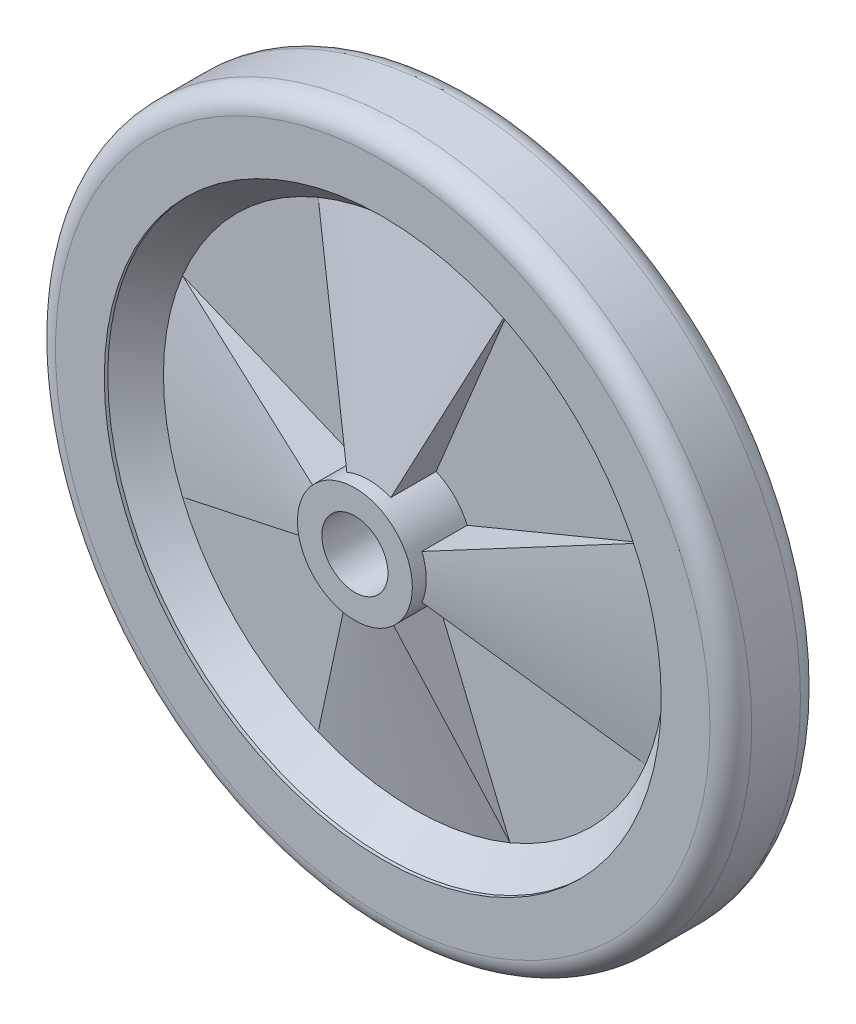
from build123d import *

# Parameters (mm, degrees)
BOSS_EXTRUDE1_DEPTH      = 10.5
BOSS_EXTRUDE1_DEPTH_BACK = 10.5
SKETCH1_R                = 8.25
SKETCH1_R_2              = 4.75
BOSS_EXTRUDE2_DEPTH      = 6.5
BOSS_EXTRUDE2_DEPTH_BACK = 6.5
SKETCH2_R                = 50
SKETCH2_R_2              = 40
BOSS_EXTRUDE3_DEPTH      = 2
BOSS_EXTRUDE3_DEPTH_BACK = 2
SKETCH3_R                = 40
SKETCH3_R_2              = 8.25
CHAMFER1_SIZE            = 4
FILLET1_R                = 3
REVOLVE1_ANGLE           = 45
CIRPATTERN1_COUNT        = 4
MIRROR1_COPY_1_ANGLE     = 45
MIRROR1_COPY_2_ANGLE     = 45
MIRROR1_COPY_3_ANGLE     = 45


# Read off the part's stored shape, not the designer's step: Revolve1
with BuildPart() as part:
    # Sketch1 → Boss-Extrude1 (new, two sides: drawn at the far end of the back side and taken through both)
    with BuildSketch(Plane.XY.offset(-BOSS_EXTRUDE1_DEPTH_BACK)):
        Circle(SKETCH1_R)
        Circle(SKETCH1_R_2, mode=Mode.SUBTRACT)
    extrude(amount=BOSS_EXTRUDE1_DEPTH + BOSS_EXTRUDE1_DEPTH_BACK)



with BuildPart() as body_2:
    # Sketch2 → Boss-Extrude2 (new, two sides: drawn at the far end of the back side and taken through both)
    with BuildSketch(Plane.XY.offset(-BOSS_EXTRUDE2_DEPTH_BACK)):
        Circle(SKETCH2_R)
        Circle(SKETCH2_R_2, mode=Mode.SUBTRACT)
    extrude(amount=BOSS_EXTRUDE2_DEPTH + BOSS_EXTRUDE2_DEPTH_BACK)


with BuildPart() as part_1:
    add(part.part)

    add(body_2.part)  # Boss-Extrude3 merges body 2
    # Sketch3 → Boss-Extrude3 (add, two sides: drawn at the far end of the back side and taken through both)
    with BuildSketch(Plane.XY.offset(-BOSS_EXTRUDE3_DEPTH_BACK)):
        Circle(SKETCH3_R)
        Circle(SKETCH3_R_2, mode=Mode.SUBTRACT)
    extrude(amount=BOSS_EXTRUDE3_DEPTH + BOSS_EXTRUDE3_DEPTH_BACK)

    # Chamfer1
    chamfer1_edges = [part_1.edges().sort_by_distance(p)[0] for p in [
        (-40, 0, -2),
        (-40, 0, 2),
    ]]
    chamfer(chamfer1_edges, length=CHAMFER1_SIZE)

    # Fillet1
    fillet1_edges = [part_1.edges().sort_by_distance(p)[0] for p in [
        (-50, 0, -6.5),
        (-50, 0, 6.5),
    ]]
    fillet(fillet1_edges, radius=FILLET1_R)

    # Revolve1 outline → Revolve1 (revolve)
    with BuildSketch(Plane(origin=(0, 0, 0), x_dir=(-0.9238795325112862, 0.3826834323650911, 0), z_dir=(0.3826834323650911, 0.9238795325112862, 0))):
        Polygon((36, 2), (8.25, 8.5), (8.25, 2), align=None)
    revolve1 = revolve(axis=Axis((0, 0, 0), (0, 0, 1)), revolution_arc=REVOLVE1_ANGLE)

    # CirPattern1: Revolve1 ×4 about axis
    cirpattern1_axis = Axis((0, 0, -10.5), (0, 0, 1))
    for i in range(1, CIRPATTERN1_COUNT):
        add(revolve1.rotate(cirpattern1_axis, i * 360 / CIRPATTERN1_COUNT))

    # Mirror1: Revolve1 across plane
    add(revolve1.mirror(Plane.XY))

    # Mirror1 copy 1 sketch → Mirror1 copy 1 (revolve)
    with BuildSketch(Plane(origin=(0, 0, 0), x_dir=(-0.38268343236509117, -0.9238795325112862, 0), z_dir=(-0.9238795325112862, 0.38268343236509117, 0))):
        Polygon((36, -2), (8.25, -8.5), (8.25, -2), align=None)
    revolve(axis=Axis((0, 0, 0), (0, 0, 1)), revolution_arc=MIRROR1_COPY_1_ANGLE)

    # Mirror1 copy 2 sketch → Mirror1 copy 2 (revolve)
    with BuildSketch(Plane(origin=(0, 0, 0), x_dir=(0.9238795325112862, -0.3826834323650912, 0), z_dir=(-0.3826834323650912, -0.9238795325112862, 0))):
        Polygon((36, -2), (8.25, -8.5), (8.25, -2), align=None)
    revolve(axis=Axis((0, 0, 0), (0, 0, 1)), revolution_arc=MIRROR1_COPY_2_ANGLE)

    # Mirror1 copy 3 sketch → Mirror1 copy 3 (revolve)
    with BuildSketch(Plane(origin=(0, 0, 0), x_dir=(0.3826834323650913, 0.9238795325112861, 0), z_dir=(0.9238795325112861, -0.3826834323650913, 0))):
        Polygon((36, -2), (8.25, -8.5), (8.25, -2), align=None)
    revolve(axis=Axis((0, 0, 0), (0, 0, 1)), revolution_arc=MIRROR1_COPY_3_ANGLE)


solid = part_1.part
